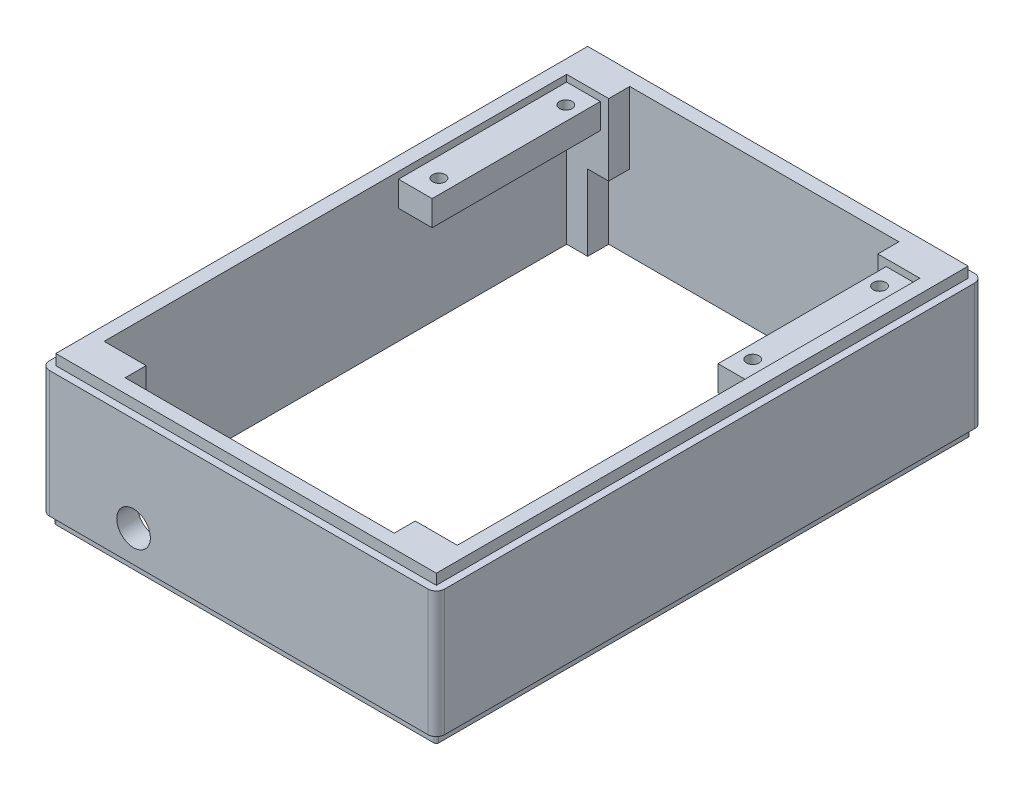
from build123d import *

# Parameters (mm, degrees)
SKETCH1_W                    = 94
SKETCH1_H                    = 130
BOSS_EXTRUDE1_DEPTH          = 32.5
SKETCH2_W                    = 90.5
SKETCH2_H                    = 126.5
BOSS_EXTRUDE2_DEPTH          = 2.5
CUT_EXTRUDE1_DEPTH           = 165.198051146
SKETCH4_W                    = 5
SKETCH4_H                    = 18
CUT_EXTRUDE2_DEPTH           = 5
SKETCH9_W                    = 5
SKETCH9_H                    = 18
CUT_EXTRUDE6_DEPTH           = 5
SKETCH11_W                   = 5
SKETCH11_H                   = 5
CUT_EXTRUDE8_DEPTH           = 18
SKETCH12_W                   = 5
SKETCH12_H                   = 18
CUT_EXTRUDE9_DEPTH           = 5
F_8_0_8_DIAMETER_HOLE1_D     = 8
F_8_0_8_DIAMETER_HOLE1_DEPTH = 5
FILLET1_R                    = 2
CUT_EXTRUDE10_START          = -2.5
CUT_EXTRUDE10_DEPTH          = 2.5
SKETCH17_W                   = 40
SKETCH17_H                   = 6
BOSS_EXTRUDE3_DEPTH          = 8
SKETCH18_W                   = 40
SKETCH18_H                   = 6
BOSS_EXTRUDE4_DEPTH          = 8
SKETCH23_R                   = 1.5
CUT_EXTRUDE11_DEPTH          = 4.4


with BuildPart() as part:
    # Sketch1 → Boss-Extrude1 (new body)
    with BuildSketch(Plane.XZ):
        with Locations((47, -65)):
            Rectangle(SKETCH1_W, SKETCH1_H)
    extrude(amount=-BOSS_EXTRUDE1_DEPTH)

    # Sketch2 → Boss-Extrude2 (add)
    with BuildSketch(Plane(origin=(0, 32.5, 0), x_dir=(-1, 0, 0), z_dir=(0, 1, 0))):
        with Locations((-47, -65)):
            Rectangle(SKETCH2_W, SKETCH2_H)
    extrude(amount=BOSS_EXTRUDE2_DEPTH)

    # Sketch3 → Cut-Extrude1 (cut, through all)
    with BuildSketch(Plane(origin=(0, 35, 0), x_dir=(-1, 0, 0), z_dir=(0, 1, 0))):
        Polygon((-83, -120), (-79, -120), (-79, -125), (-15, -125), (-15, -120), (-5, -120), (-5, -10), (-15, -10), (-15, -5), (-79, -5), (-79, -10), (-89, -10), (-89, -96), (-89, -120), align=None)
    extrude(amount=-CUT_EXTRUDE1_DEPTH, mode=Mode.SUBTRACT)

    # Sketch4 → Cut-Extrude2 (cut)
    with BuildSketch(Plane(origin=(0, 0, -10), x_dir=(-1, 0, 0), z_dir=(0, 0, -1))):
        with Locations((-12.5, 9)):
            Rectangle(SKETCH4_W, SKETCH4_H)
    extrude(amount=-CUT_EXTRUDE2_DEPTH, mode=Mode.SUBTRACT)

    # Sketch9 → Cut-Extrude6 (cut)
    with BuildSketch(Plane(origin=(0, 0, -10), x_dir=(-1, 0, 0), z_dir=(0, 0, -1))):
        with Locations((-81.5, 9)):
            Rectangle(SKETCH9_W, SKETCH9_H)
    extrude(amount=-CUT_EXTRUDE6_DEPTH, mode=Mode.SUBTRACT)

    # Sketch11 → Cut-Extrude8 (cut)
    with BuildSketch(Plane.XZ):
        with Locations((12.5, -122.5)):
            Rectangle(SKETCH11_W, SKETCH11_H)
    extrude(amount=-CUT_EXTRUDE8_DEPTH, mode=Mode.SUBTRACT)

    # Sketch12 → Cut-Extrude9 (cut)
    with BuildSketch(Plane.XY.offset(-120)):
        with Locations((81.5, 9)):
            Rectangle(SKETCH12_W, SKETCH12_H)
    extrude(amount=-CUT_EXTRUDE9_DEPTH, mode=Mode.SUBTRACT)

    # Ø8.0 (8) Diameter Hole1
    with Locations(Plane(origin=(0, 0, -5), x_dir=(-1, 0, 0), z_dir=(0, 0, -1))):
        with Locations((-22, 10)):
            Hole(F_8_0_8_DIAMETER_HOLE1_D / 2, depth=F_8_0_8_DIAMETER_HOLE1_DEPTH)

    # Fillet1
    fillet1_edges = [part.edges().sort_by_distance(p)[0] for p in [
        (0, 16.25, -130),
        (94, 16.25, -130),
        (0, 16.25, 0),
        (94, 16.25, 0),
    ]]
    fillet(fillet1_edges, radius=FILLET1_R)

    # Sketch16 → Cut-Extrude10 (cut)
    with BuildSketch(Plane.XZ.offset(CUT_EXTRUDE10_START)):
        with BuildLine():
            Line((0, -2), (0, -128))
            ThreePointArc((0, -128), (0.585786438, -129.414213562), (2, -130))
            Line((2, -130), (92, -130))
            ThreePointArc((92, -130), (93.414213562, -129.414213562), (94, -128))
            Line((94, -128), (94, -2))
            ThreePointArc((94, -2), (93.414213562, -0.585786438), (92, 0))
            Line((92, 0), (2, 0))
            ThreePointArc((2, 0), (0.585786438, -0.585786438), (0, -2))
        make_face()
        with BuildLine():
            Line((1.5, -2), (1.5, -128))
            ThreePointArc((1.5, -128), (1.646446609, -128.353553391), (2, -128.5))
            Line((2, -128.5), (92, -128.5))
            ThreePointArc((92, -128.5), (92.353553391, -128.353553391), (92.5, -128))
            Line((92.5, -128), (92.5, -2))
            ThreePointArc((92.5, -2), (92.353553391, -1.646446609), (92, -1.5))
            Line((92, -1.5), (2, -1.5))
            ThreePointArc((2, -1.5), (1.646446609, -1.646446609), (1.5, -2))
        make_face(mode=Mode.SUBTRACT)
    extrude(amount=CUT_EXTRUDE10_DEPTH, mode=Mode.SUBTRACT)

    # Sketch17 → Boss-Extrude3 (add)
    with BuildSketch(Plane(origin=(5, 0, 0), x_dir=(0, 0, -1), z_dir=(1, 0, 0))):
        with Locations((100, 30.4)):
            Rectangle(SKETCH17_W, SKETCH17_H)
    extrude(amount=BOSS_EXTRUDE3_DEPTH)

    # Sketch18 → Boss-Extrude4 (add)
    with BuildSketch(Plane.ZY.offset(-89)):
        with Locations((-100, 30.4)):
            Rectangle(SKETCH18_W, SKETCH18_H)
    extrude(amount=BOSS_EXTRUDE4_DEPTH)

    # Sketch23 → Cut-Extrude11 (cut)
    with BuildSketch(Plane(origin=(0, 33.4, 0), x_dir=(1, 0, 0), z_dir=(0, 1, 0))):
        with Locations((9.61875, 115.175)):
            Circle(SKETCH23_R)
        with Locations((9.61875, 85.0125)):
            Circle(SKETCH23_R)
        with Locations((84.23125, 115.175)):
            Circle(SKETCH23_R)
        with Locations((84.23125, 85.0125)):
            Circle(SKETCH23_R)
    extrude(amount=-CUT_EXTRUDE11_DEPTH, mode=Mode.SUBTRACT)


solid = part.part
